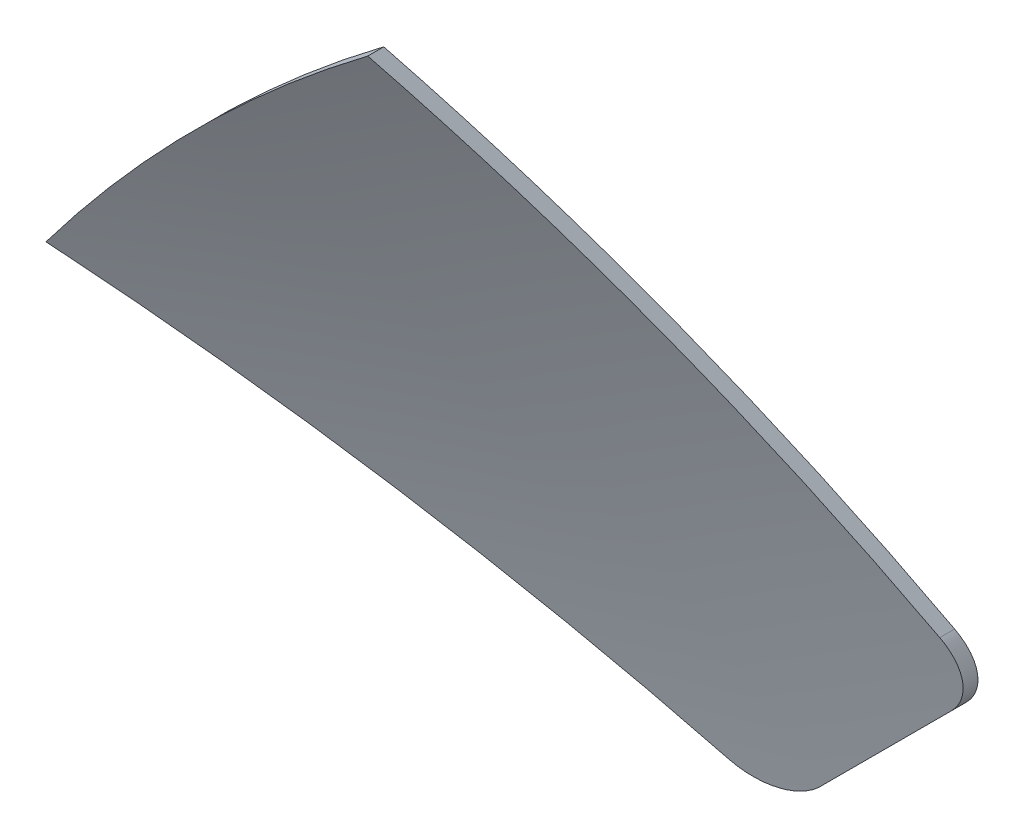
from build123d import *

# Parameters (mm, degrees)
REVOLVE_1_ANGLE     = 180
SHELL_1_T           = 0.5
SKETCH_1_OUTSIDE_W  = 328.82
SKETCH_1_OUTSIDE_H  = 328.82
CUT_EXTRUDE_1_DEPTH = 323
FILLET_1_R          = 2


with BuildPart() as part:
    # 草图2 → 旋转1 (revolve)
    with BuildSketch(Plane.XY):
        with BuildLine():
            Line((0, -125.2), (0, 125.2))
            ThreePointArc((0, 125.2), (-125.2, 0), (0, -125.2))
        make_face()
    revolve(axis=Axis((0, 151.670850912, 0), (0, -1, 0)), revolution_arc=REVOLVE_1_ANGLE)

    # 抽壳1
    shell_1_openings = [part.faces().sort_by_distance(p)[0] for p in [
        (0, 0, 0),
    ]]
    offset(amount=SHELL_1_T, openings=shell_1_openings)

    # 草图1 outside → 切除-拉伸1 (cut)
    with BuildSketch(Plane.XY):
        Rectangle(SKETCH_1_OUTSIDE_W, SKETCH_1_OUTSIDE_H)
        with BuildLine():
            Line((-45.921541828, 34.604363831), (-28.692164813, 21.621097001))
            Line((-28.692164813, 21.621097001), (-21.621097001, 28.692164813))
            Line((-21.621097001, 28.692164813), (-34.604363831, 45.921541828))
            ThreePointArc((-34.604363831, 45.921541828), (-40.658639918, 40.658639918), (-45.921541828, 34.604363831))
        make_face(mode=Mode.SUBTRACT)
    extrude(amount=-CUT_EXTRUDE_1_DEPTH, mode=Mode.SUBTRACT)

    # 圆角1
    # the kernel refuses this fillet: 2 mm, written as the material it takes off along each edge
    with BuildSketch(Plane(origin=(-21.621097001, 28.692164813, -115.588247879), x_dir=(-0.7071067811865281, -0.707106781186567, 0), z_dir=(0, 0, -1)), Plane(origin=(-28.692164813, 21.621097001, -115.588247879), x_dir=(-0.7986355100472948, 0.6018150231520455, 0), z_dir=(0, 0, -1))) as fillet_1_piece_1:
        with BuildLine():
            CenterArc((FILLET_1_R * 0.869286737816, FILLET_1_R), FILLET_1_R, 188, 82)
            Line((-FILLET_1_R * 0.120981330925, FILLET_1_R * 0.86082689904), (0, 0))
            Line((0, 0), (FILLET_1_R * 0.869286737816, 0))
        make_face()
    extrude(amount=9.214725038, mode=Mode.SUBTRACT)


solid = part.part
